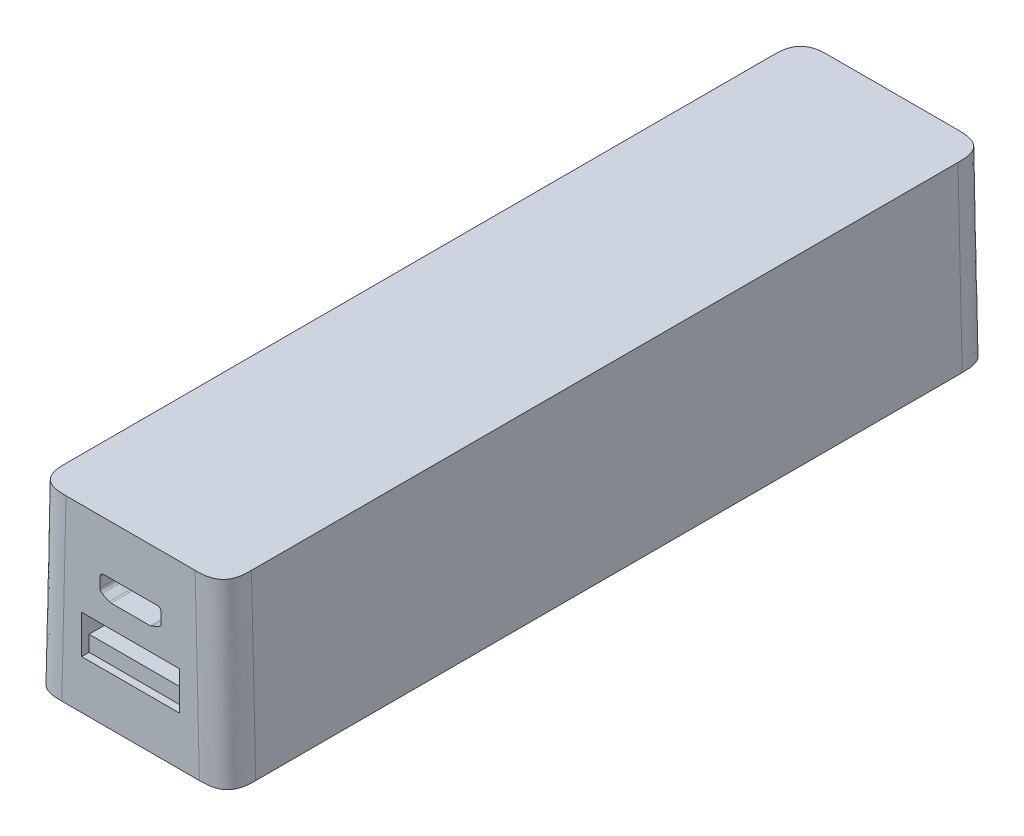
from build123d import *

# Parameters (mm, degrees)
BOSS_EXTRUDE2_DEPTH = 97.5
FILLET4_SIZE        = 3.6
SKETCH2_W           = 12.5
SKETCH2_H           = 4.91
CUT_EXTRUDE1_DEPTH  = 9.85
CUT_EXTRUDE2_DEPTH  = 10
SKETCH4_W           = 12.355512527
SKETCH4_H           = 2
BOSS_EXTRUDE3_DEPTH = 9


with BuildPart() as part:
    # Sketch1 → Boss-Extrude2 (new body)
    with BuildSketch(Plane.XY):
        Polygon((12.395, -11.5), (-12.395, -11.5), (-11.85, 11.5), (11.85, 11.5), align=None)
    extrude(amount=BOSS_EXTRUDE2_DEPTH)

    # Fillet4
    # a fillet whose section is not a circle: 3.6 mm, written as the material it takes off along each edge
    with BuildSketch(Plane(origin=(-12.608201023, -20.497474386, 0), x_dir=(0, 0, 1), z_dir=(0.023689002610023418, 0.9997193762028135, 0)), Plane(origin=(11.636798977, 20.497474386, 0), x_dir=(0, 0, 1), z_dir=(0.023689002610022953, -0.9997193762028134, 0))) as fillet4_piece_1:
        with BuildLine():
            add(Edge.make_bspline([(FILLET4_SIZE, 0), (FILLET4_SIZE * 0.831801948466, 0), (FILLET4_SIZE * 0.663603896932, 0), (FILLET4_SIZE * 0.292893218813, FILLET4_SIZE * 0.0716919198361), (FILLET4_SIZE * 0.0716919198361, FILLET4_SIZE * 0.292893218813), (0, FILLET4_SIZE * 0.663603896932), (0, FILLET4_SIZE * 0.831801948466), (0, FILLET4_SIZE)], knots=[0, 0, 0, 0, 0, 0, 0.5, 0.5, 1, 1, 1, 1, 1, 1], degree=5))
            Line((0, FILLET4_SIZE), (0, 0))
            Line((0, 0), (FILLET4_SIZE, 0))
        make_face()
    extrude(amount=41.006456159, mode=Mode.SUBTRACT)
    with BuildSketch(Plane(origin=(-12.608201023, -20.497474386, 97.5), x_dir=(0, 0, -1), z_dir=(0.023689002610023418, 0.9997193762028135, 0)), Plane(origin=(11.636798977, 20.497474386, 97.5), x_dir=(0, 0, -1), z_dir=(0.023689002610022953, -0.9997193762028134, 0))) as fillet4_piece_2:
        with BuildLine():
            add(Edge.make_bspline([(FILLET4_SIZE, 0), (FILLET4_SIZE * 0.831801948466, 0), (FILLET4_SIZE * 0.663603896932, 0), (FILLET4_SIZE * 0.292893218813, -FILLET4_SIZE * 0.0716919198361), (FILLET4_SIZE * 0.0716919198361, -FILLET4_SIZE * 0.292893218813), (0, -FILLET4_SIZE * 0.663603896932), (0, -FILLET4_SIZE * 0.831801948466), (0, -FILLET4_SIZE)], knots=[0, 0, 0, 0, 0, 0, 0.5, 0.5, 1, 1, 1, 1, 1, 1], degree=5))
            Line((0, -FILLET4_SIZE), (0, 0))
            Line((0, 0), (FILLET4_SIZE, 0))
        make_face()
    extrude(amount=41.006456159, mode=Mode.SUBTRACT)

    # Sketch2 → Cut-Extrude1 (cut)
    with BuildSketch(Plane.XY.offset(97.5)):
        with Locations((0, -2.845)):
            Rectangle(SKETCH2_W, SKETCH2_H)
    extrude(amount=-CUT_EXTRUDE1_DEPTH, mode=Mode.SUBTRACT)

    # Sketch3 → Cut-Extrude2 (cut)
    with BuildSketch(Plane.XY.offset(97.5)):
        with BuildLine():
            Line((-3.629235437, 2.994588956), (-2.719235437, 2.5506273))
            ThreePointArc((-2.719235437, 2.5506273), (-2.612502556, 2.512821208), (-2.5, 2.5))
            Line((-2.5, 2.5), (2.5, 2.5))
            ThreePointArc((2.5, 2.5), (2.612502556, 2.512821208), (2.719235437, 2.5506273))
            Line((2.719235437, 2.5506273), (3.629235437, 2.994588956))
            ThreePointArc((3.629235437, 2.994588956), (3.834038747, 3.179025548), (3.91, 3.443961655))
            Line((3.91, 3.443961655), (3.91, 4.7))
            ThreePointArc((3.91, 4.7), (3.763553391, 5.053553391), (3.41, 5.2))
            Line((3.41, 5.2), (-3.41, 5.2))
            ThreePointArc((-3.41, 5.2), (-3.763553391, 5.053553391), (-3.91, 4.7))
            Line((-3.91, 4.7), (-3.91, 3.443961655))
            ThreePointArc((-3.91, 3.443961655), (-3.834038747, 3.179025548), (-3.629235437, 2.994588956))
        make_face()
    extrude(amount=-CUT_EXTRUDE2_DEPTH, mode=Mode.SUBTRACT)

    # Sketch4 → Boss-Extrude3 (add)
    with BuildSketch(Plane.XY.offset(87.65)):
        with Locations((0.018279413, -4.198858777)):
            Rectangle(SKETCH4_W, SKETCH4_H)
    extrude(amount=BOSS_EXTRUDE3_DEPTH)


solid = part.part
